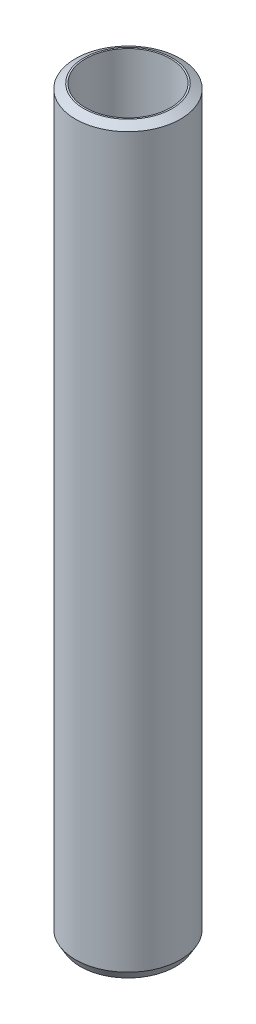
from build123d import *
from OCP.BRepFilletAPI import BRepFilletAPI_MakeChamfer

# Parameters (mm, degrees)
SKETCH1_R           = 42.5
BOSS_EXTRUDE1_DEPTH = 600
SKETCH2_R           = 34.412762192
CUT_EXTRUDE1_DEPTH  = 604.002902149
CHAMFER1_SIZE       = 3.94478288
CHAMFER1_SIZE2      = 6.832564373


with BuildPart() as part:
    # Sketch1 → Boss-Extrude1 (new body)
    with BuildSketch(Plane(origin=(0, 0, 0), x_dir=(1, 0, 0), z_dir=(0, 1, 0))):
        Circle(SKETCH1_R)
    extrude(amount=BOSS_EXTRUDE1_DEPTH)

    # Sketch2 → Cut-Extrude1 (cut, through all)
    with BuildSketch(Plane(origin=(0, 0, 0), x_dir=(1, 0, 0), z_dir=(0, 1, 0))):
        Circle(SKETCH2_R)
    extrude(amount=CUT_EXTRUDE1_DEPTH, mode=Mode.SUBTRACT)

    # Chamfer1: one chamfer whose edges measure the first distance from different faces: ONE call of the kernel's chamfer builder (chamfer() names one face for all edges)
    chamfer1_edges_1 = [part.edges().sort_by_distance(p)[0] for p in [
        (-42.5, 600, 0),
    ]]
    chamfer1_side_1 = [part.faces().sort_by_distance(p)[0] for p in [
        (-42.5, 300, 0),
    ]]
    chamfer1_edges_2 = [part.edges().sort_by_distance(p)[0] for p in [
        (-42.5, 0, 0),
    ]]
    chamfer1_side_2 = [part.faces().sort_by_distance(p)[0] for p in [
        (-41.297918472, 0, 0),
    ]]
    chamfer1 = BRepFilletAPI_MakeChamfer(part.part.solid().wrapped)
    for e in chamfer1_edges_1:
        chamfer1.Add(CHAMFER1_SIZE, CHAMFER1_SIZE2, e.wrapped, chamfer1_side_1[0].wrapped)  # the first distance lies on this face
    for e in chamfer1_edges_2:
        chamfer1.Add(CHAMFER1_SIZE, CHAMFER1_SIZE2, e.wrapped, chamfer1_side_2[0].wrapped)  # the first distance lies on this face
    add(Compound.cast(chamfer1.Shape()), mode=Mode.REPLACE)


solid = part.part
